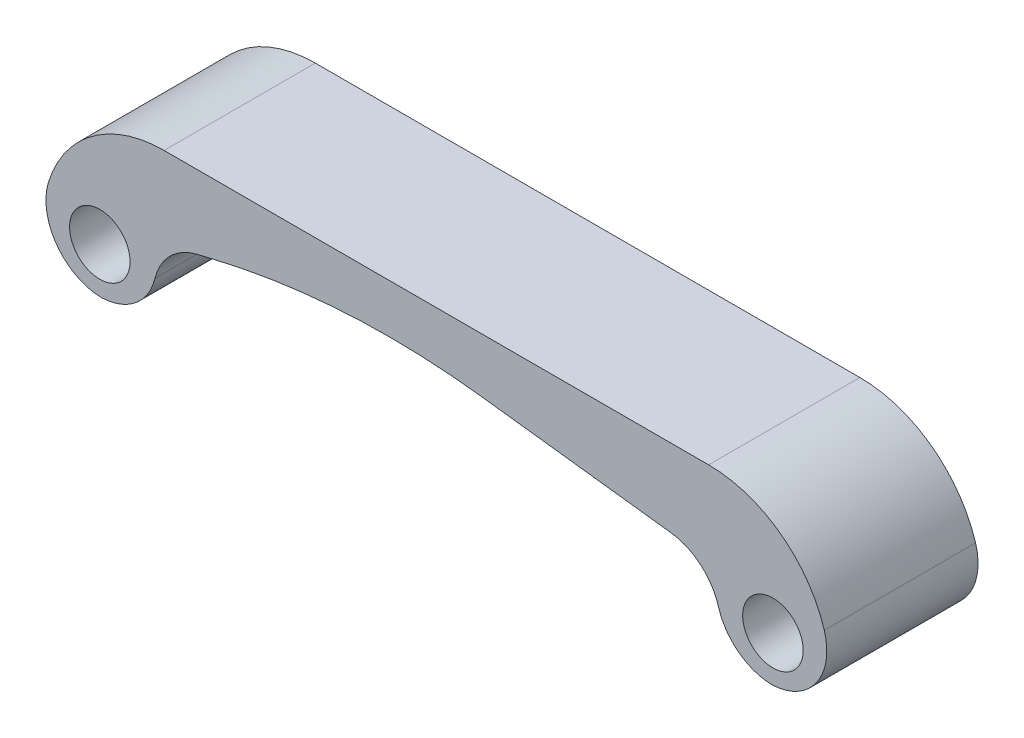
from build123d import *

# Parameters (mm, degrees)
SKETCH1_R           = 2
BOSS_EXTRUDE1_DEPTH = 5
FILLET1_R           = 50
FILLET2_R           = 8
FILLET3_R           = 3.75
FILLET4_R           = 3.75


with BuildPart() as part:
    # Sketch1 → Boss-Extrude1 (new, symmetric)
    with BuildSketch(Plane.XY):
        Polygon((0, 0), (-7.5, 0), (-7.5, 8), (-7.5, 10.5), (44.5, 10.5), (44.5, 8), (44.5, 0), (37, 0), (37, 5), (12.5, 8), (0, 5), align=None)
        with Locations((-3.75, 3)):
            Circle(SKETCH1_R, mode=Mode.SUBTRACT)
        with Locations((40.75, 3)):
            Circle(SKETCH1_R, mode=Mode.SUBTRACT)
    extrude(amount=BOSS_EXTRUDE1_DEPTH, both=True)

    # Fillet1
    fillet1_edges = [part.edges().sort_by_distance(p)[0] for p in [
        (12.5, 8, 0),
    ]]
    fillet(fillet1_edges, radius=FILLET1_R)

    # Fillet2
    fillet2_edges = [part.edges().sort_by_distance(p)[0] for p in [
        (-7.5, 10.5, 0),
        (44.5, 10.5, 0),
    ]]
    fillet(fillet2_edges, radius=FILLET2_R)

    # Fillet3
    # the kernel refuses this fillet: 3.75 mm, written as the material it takes off along each edge
    with BuildSketch(Plane(origin=(44.5, 0, 17.164560514), x_dir=(-0.0727207133761252, 0.997352343881573, 0), z_dir=(0, 0, -1))) as fillet3_piece_1:
        with BuildLine():
            CenterArc((4.026444062, -3.654851704), FILLET3_R, 77.065635914, 107.104635177)
            Line((0.286372773, -3.927554379), (-0.087634356, -3.954824646))
            Line((-0.087634356, -3.954824646), (-0.374007129, -0.027270268))
            Line((-0.374007129, -0.027270268), (-0.027270268, 0.374007129))
            ThreePointArc((-0.027270268, 0.374007129), (2.466110592, 0.555808912), (4.94976222, 0.36548517))
            Line((4.94976222, 0.36548517), (4.865824206, 0))
        make_face()
    extrude(amount=34.329121028, mode=Mode.SUBTRACT)
    with BuildSketch(Plane(origin=(37, 0, 14.375), x_dir=(1, 0, 0), z_dir=(0, 0, -1)), Plane(origin=(0, 0, -14.375), x_dir=(-1, 0, 0), z_dir=(0, 0, 1))) as fillet3_piece_2:
        with BuildLine():
            CenterArc((FILLET3_R, -FILLET3_R), FILLET3_R, 90, 90)
            Line((0, -FILLET3_R), (0, 0))
            Line((0, 0), (FILLET3_R, 0))
        make_face()
    extrude(amount=28.75, mode=Mode.SUBTRACT)
    with BuildSketch(Plane(origin=(-7.5, 0, 17.164560514), x_dir=(0.07272071337612518, 0.997352343881573, 0), z_dir=(0, 0, -1))) as fillet3_piece_3:
        with BuildLine():
            CenterArc((4.026444062, 3.654851704), FILLET3_R, 175.829728909, 107.104635177)
            Line((0.286372773, 3.927554379), (-0.087634356, 3.954824646))
            Line((-0.087634356, 3.954824646), (-0.374007129, 0.027270268))
            Line((-0.374007129, 0.027270268), (-0.027270268, -0.374007129))
            ThreePointArc((-0.027270268, -0.374007129), (2.466110592, -0.555808912), (4.94976222, -0.36548517))
            Line((4.94976222, -0.36548517), (4.865824206, 0))
        make_face()
    extrude(amount=34.329121028, mode=Mode.SUBTRACT)

    # Fillet4
    fillet4_edges = [part.edges().sort_by_distance(p)[0] for p in [
        (0, 5, 0),
        (37, 5, 0),
    ]]
    fillet(fillet4_edges, radius=FILLET4_R)


solid = part.part
